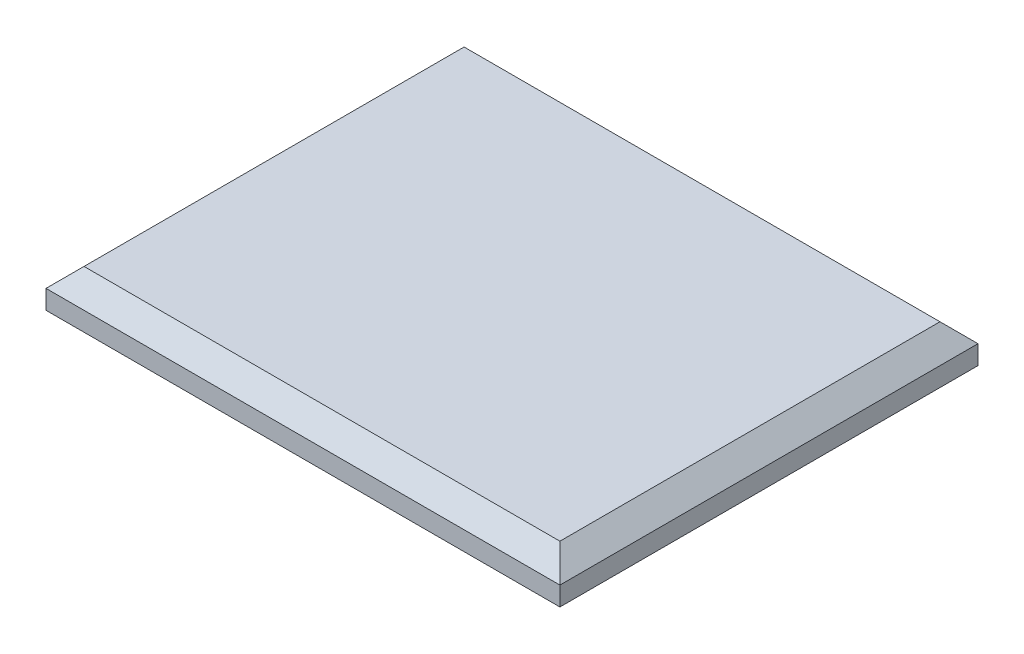
from build123d import *

# Parameters (mm, degrees)
SKETCH1_W           = 135.21
SKETCH1_H           = 110
BOSS_EXTRUDE1_DEPTH = 10
CHAMFER1_SIZE       = 5


with BuildPart() as part:
    # Sketch1 → Boss-Extrude1 (new body)
    with BuildSketch(Plane(origin=(0, 0, 0), x_dir=(1, 0, 0), z_dir=(0, 1, 0))):
        Rectangle(SKETCH1_W, SKETCH1_H)
    extrude(amount=BOSS_EXTRUDE1_DEPTH)

    # Chamfer1
    chamfer1_edges = [part.edges().sort_by_distance(p)[0] for p in [
        (0, 10, -55),
        (67.605, 10, 0),
        (0, 10, 55),
        (-67.605, 10, 0),
    ]]
    chamfer(chamfer1_edges, length=CHAMFER1_SIZE)


solid = part.part
